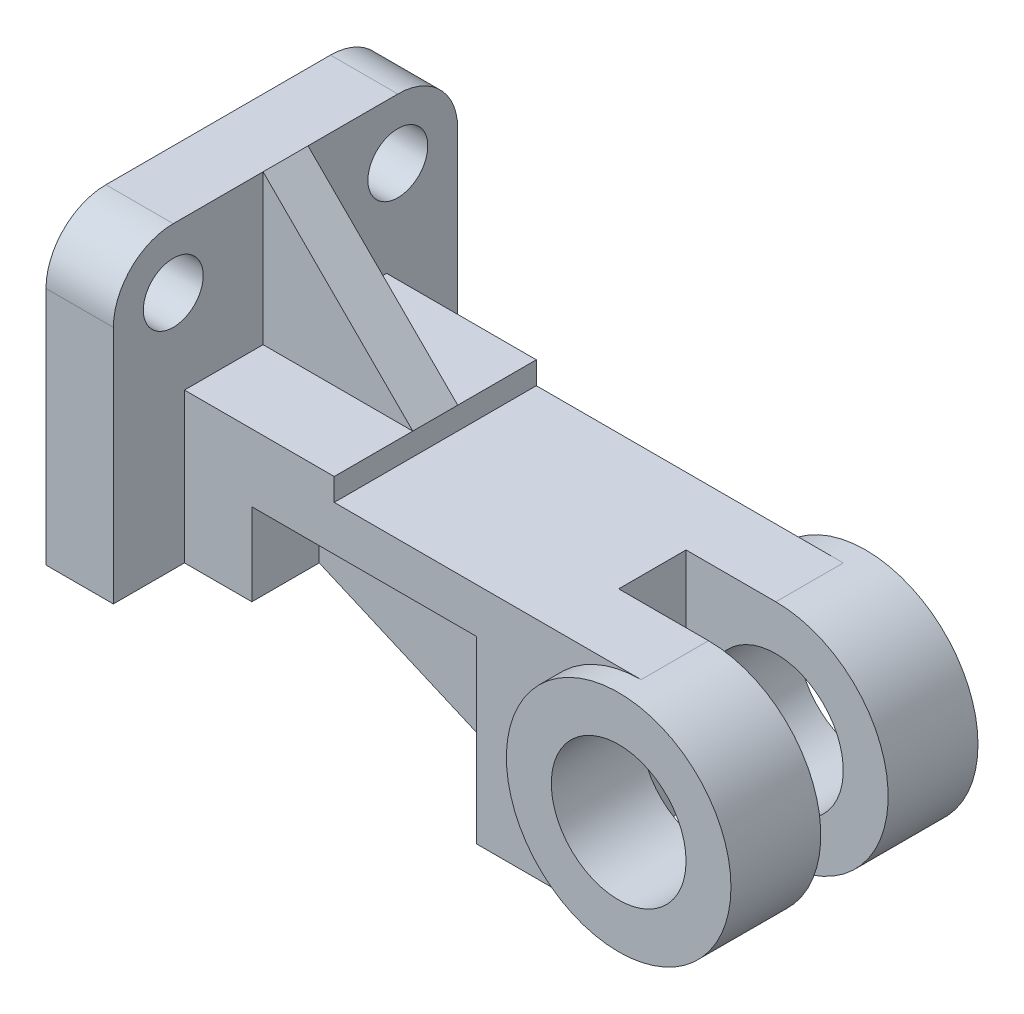
from build123d import *

# Parameters (mm, degrees)
BOSS_EXTRUDE1_DEPTH     = 27
SKETCH2_3_R             = 30
BOSS_EXTRUDE2_DEPTH     = 33
CUT_EXTRUDE1_DEPTH      = 66
CUT_EXTRUDE1_DEPTH_BACK = 66
SKETCH2_4_R             = 18
CUT_EXTRUDE2_DEPTH      = 18
SKETCH4_R               = 8
BOSS_EXTRUDE3_DEPTH     = 18
SKETCH5_W               = 73.157343746
SKETCH5_H               = 18
CUT_EXTRUDE3_DEPTH      = 160.110024826
BOSS_EXTRUDE4_DEPTH     = 6


with BuildPart() as part:
    # Sketch2 → Boss-Extrude1 (new, symmetric)
    with BuildSketch(Plane.XY):
        with BuildLine():
            Line((-44, -30), (0, -30))
            ThreePointArc((0, -30), (30, 0), (0, 30))
            Line((0, 30), (-82, 30))
            Line((-82, 30), (-82, 36))
            Line((-82, 36), (-122, 36))
            Line((-122, 36), (-122, -4))
            Line((-122, -4), (-104, -4))
            Line((-104, -4), (-44, -30))
        make_face()
    extrude(amount=BOSS_EXTRUDE1_DEPTH, both=True)

    # Sketch2<3> → Boss-Extrude2 (add, symmetric)
    with BuildSketch(Plane.XY):
        Circle(SKETCH2_3_R)
    extrude(amount=BOSS_EXTRUDE2_DEPTH, both=True)

    # Sketch2<4> → Cut-Extrude1 (cut, two sides: drawn at the far end of the back side and taken through both)
    with BuildSketch(Plane.XY.offset(-CUT_EXTRUDE1_DEPTH_BACK)):
        Circle(SKETCH2_4_R)
    extrude(amount=CUT_EXTRUDE1_DEPTH + CUT_EXTRUDE1_DEPTH_BACK, mode=Mode.SUBTRACT)

    # Sketch3 → Cut-Extrude2 (cut)
    with BuildSketch(Plane.XY.offset(27)):
        Polygon((-104, -4), (-104, 18), (-44, 18), (-44, -30), align=None)
    cut_extrude2 = extrude(amount=-CUT_EXTRUDE2_DEPTH, mode=Mode.SUBTRACT)

    # Mirror1: Cut-Extrude2 across plane
    add(cut_extrude2.mirror(Plane.XY), mode=Mode.SUBTRACT)

    # Sketch4 → Boss-Extrude3 (add)
    with BuildSketch(Plane.ZY.offset(122)):
        with BuildLine():
            Line((-30, 76), (30, 76))
            ThreePointArc((30, 76), (41.313708499, 71.313708499), (46, 60))
            Line((46, 60), (46, -4))
            Line((46, -4), (-46, -4))
            Line((-46, -4), (-46, 60))
            ThreePointArc((-46, 60), (-41.313708499, 71.313708499), (-30, 76))
        make_face()
        with Locations((-30, 60)):
            Circle(SKETCH4_R, mode=Mode.SUBTRACT)
        with Locations((30, 60)):
            Circle(SKETCH4_R, mode=Mode.SUBTRACT)
    extrude(amount=BOSS_EXTRUDE3_DEPTH)

    # Sketch5 → Cut-Extrude3 (cut, through all)
    with BuildSketch(Plane(origin=(0, 30, 0), x_dir=(1, 0, 0), z_dir=(0, 1, 0))):
        with Locations((12.578671873, 0)):
            Rectangle(SKETCH5_W, SKETCH5_H)
    extrude(amount=-CUT_EXTRUDE3_DEPTH, mode=Mode.SUBTRACT)

    # Sketch6 → Boss-Extrude4 (add, symmetric)
    with BuildSketch(Plane.XY):
        Polygon((-122, 60), (-122, 76), (-82, 36), (-122, 36), align=None)
    extrude(amount=BOSS_EXTRUDE4_DEPTH, both=True)


solid = part.part
